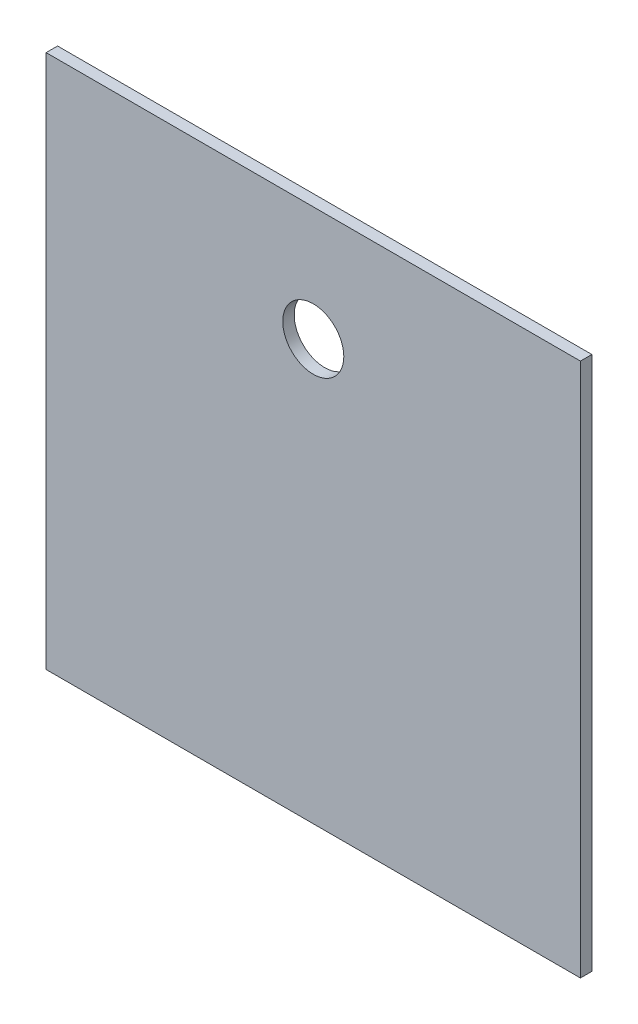
from build123d import *

# Parameters (mm, degrees)
SCHIZZO1_W                   = 700
SCHIZZO1_H                   = 700
ESTRUSIONE_ESTRUSIONE1_DEPTH = 15
SCHIZZO2_R                   = 40
TAGLIO_ESTRUSIONE1_DEPTH     = 15


with BuildPart() as part:
    # Schizzo1 → Estrusione-Estrusione1 (new body)
    with BuildSketch(Plane.XY):
        Rectangle(SCHIZZO1_W, SCHIZZO1_H)
    extrude(amount=ESTRUSIONE_ESTRUSIONE1_DEPTH)

    # Schizzo2 → Taglio-Estrusione1 (cut)
    with BuildSketch(Plane.XY.offset(15)):
        with Locations((0, 200)):
            Circle(SCHIZZO2_R)
    extrude(amount=-TAGLIO_ESTRUSIONE1_DEPTH, mode=Mode.SUBTRACT)


solid = part.part
